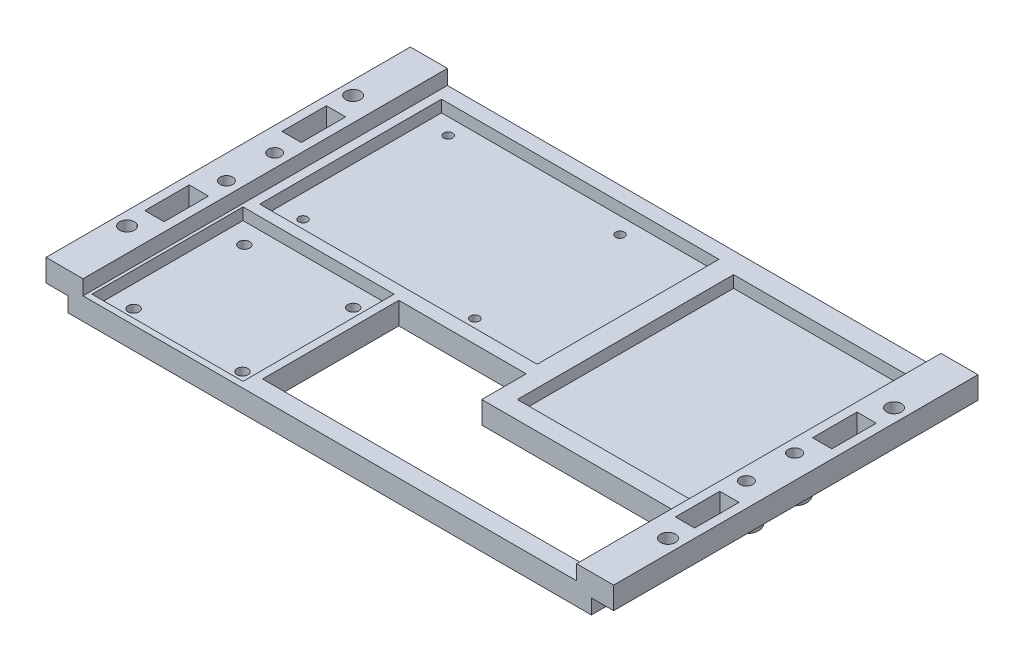
from build123d import *

# Parameters (mm, degrees)
PLATEFRAME_DEPTH          = 150
SKETCH3_R                 = 2.5
HOLESUPPORT_DEPTH         = 244.653052515
SKETCH4_R                 = 4.15
SKETCH4_R_2               = 2.15
CYLINDRICALSUPPORTS_DEPTH = 12.5
SKETCH5_W                 = 43
SKETCH5_H                 = 43
SKETCH5_W_2               = 89.65
SKETCH5_H_2               = 57.35
SKETCH5_W_3               = 58
SKETCH5_H_3               = 73
ITEMLAYOUT_DEPTH          = 4
HOLECUTOUT_DEPTH          = 7.5
SKETCH7_R                 = 1.5
HOLERASPBERRYPI_DEPTH     = 3.5
SKETCH8_R                 = 1.85
HOLEMOTORDRIVER_DEPTH     = 3.5
SKETCH10_W                = 45
SKETCH10_H                = 45
SKETCH10_W_2              = 43
SKETCH10_H_2              = 43
CUTMOTORDRIVER_DEPTH      = 4
SKETCH11_W                = 93.65
SKETCH11_H                = 61.35
SKETCH11_W_2              = 89.65
SKETCH11_H_2              = 57.35
CUTPASPBERRYPI_DEPTH      = 4
SKETCH12_W                = 191.6
SKETCH12_H                = 13
SKETCH12_H_2              = 14
CUTPLATEEDGES_DEPTH       = 12.5
SKETCH13_W                = 6.5
SKETCH13_H                = 15
CUTSHELLHOLES_DEPTH       = 12.5
SKETCH14_W                = 51
SKETCH14_H                = 51
CUTMOTORDRIVER2_DEPTH     = 4
SKETCH15_R                = 2.5
STANDOFFHOLES_DEPTH       = 236.293030071


with BuildPart() as part:
    # Sketch2 → PlateFrame (new body)
    with BuildSketch(Plane.XY):
        Polygon((179.1, 12.5), (191.6, 12.5), (191.6, 5), (184.1, 5), (184.1, 0), (7.5, 0), (7.5, 5), (0, 5), (0, 12.5), (12.5, 12.5), (12.5, 7.5), (179.1, 7.5), align=None)
    extrude(amount=PLATEFRAME_DEPTH)

    # Sketch3 → HoleSupport (cut, through all)
    with BuildSketch(Plane(origin=(0, 12.5, 0), x_dir=(1, 0, 0), z_dir=(0, 1, 0))):
        with Locations((8.05, -66.85)):
            Circle(SKETCH3_R)
        with Locations((8.05, -83.15)):
            Circle(SKETCH3_R)
        with Locations((183.55, -66.85)):
            Circle(SKETCH3_R)
        with Locations((183.55, -83.15)):
            Circle(SKETCH3_R)
    extrude(amount=-HOLESUPPORT_DEPTH, mode=Mode.SUBTRACT)

    # Sketch4 → CylindricalSupports (add)
    # profile 1 of 4: a face of its own
    with BuildSketch(Plane(origin=(0, 12.5, 0), x_dir=(1, 0, 0), z_dir=(0, 1, 0))):
        with Locations((183.55, -66.85)):
            Circle(SKETCH4_R)
        with Locations((183.55, -66.85)):
            Circle(SKETCH4_R_2, mode=Mode.SUBTRACT)
    # profile 2 of 4: a face of its own
    with BuildSketch(Plane(origin=(0, 12.5, 0), x_dir=(1, 0, 0), z_dir=(0, 1, 0))):
        with Locations((183.55, -83.15)):
            Circle(SKETCH4_R)
        with Locations((183.55, -83.15)):
            Circle(SKETCH4_R_2, mode=Mode.SUBTRACT)
    # profile 3 of 4: a face of its own
    with BuildSketch(Plane(origin=(0, 12.5, 0), x_dir=(1, 0, 0), z_dir=(0, 1, 0))):
        with Locations((8.05, -66.85)):
            Circle(SKETCH4_R)
        with Locations((8.05, -66.85)):
            Circle(SKETCH4_R_2, mode=Mode.SUBTRACT)
    # profile 4 of 4: a face of its own
    with BuildSketch(Plane(origin=(0, 12.5, 0), x_dir=(1, 0, 0), z_dir=(0, 1, 0))):
        with Locations((8.05, -83.15)):
            Circle(SKETCH4_R)
        with Locations((8.05, -83.15)):
            Circle(SKETCH4_R_2, mode=Mode.SUBTRACT)
    extrude(amount=-CYLINDRICALSUPPORTS_DEPTH)

    # Sketch5 → ItemLayout (cut)
    with BuildSketch(Plane(origin=(0, 7.5, 0), x_dir=(1, 0, 0), z_dir=(0, 1, 0))):
        with Locations((39, -108.5)):
            Rectangle(SKETCH5_W, SKETCH5_H)
        with Locations((62.325, -48.675)):
            Rectangle(SKETCH5_W_2, SKETCH5_H_2)
        with Locations((145.1, -56.5)):
            Rectangle(SKETCH5_W_3, SKETCH5_H_3)
    extrude(amount=-ITEMLAYOUT_DEPTH, mode=Mode.SUBTRACT)

    # Sketch6 → HoleCutout (cut)
    with BuildSketch(Plane(origin=(0, 7.5, 0), x_dir=(1, 0, 0), z_dir=(0, 1, 0))):
        Polygon((67.1, -84), (110.1, -84), (110.1, -99), (174.1, -99), (174.1, -130), (110.1, -130), (67.1, -130), align=None)
    extrude(amount=-HOLECUTOUT_DEPTH, mode=Mode.SUBTRACT)

    # Sketch7 → HoleRaspberryPi (cut)
    with BuildSketch(Plane(origin=(0, 3.5, 0), x_dir=(1, 0, 0), z_dir=(0, 1, 0))):
        with Locations((23.26, -23.5)):
            Circle(SKETCH7_R)
        with Locations((23.26, -72.5)):
            Circle(SKETCH7_R)
        with Locations((81.26, -72.5)):
            Circle(SKETCH7_R)
        with Locations((81.26, -23.5)):
            Circle(SKETCH7_R)
    extrude(amount=-HOLERASPBERRYPI_DEPTH, mode=Mode.SUBTRACT)

    # Sketch8 → HoleMotorDriver (cut)
    with BuildSketch(Plane(origin=(0, 3.5, 0), x_dir=(1, 0, 0), z_dir=(0, 1, 0))):
        with Locations((57.56, -127.24)):
            Circle(SKETCH8_R)
        with Locations((57.56, -89.86)):
            Circle(SKETCH8_R)
        with Locations((20.81, -89.86)):
            Circle(SKETCH8_R)
        with Locations((20.81, -127.24)):
            Circle(SKETCH8_R)
    extrude(amount=-HOLEMOTORDRIVER_DEPTH, mode=Mode.SUBTRACT)

    # Sketch10 → CutMotorDriver (cut)
    with BuildSketch(Plane(origin=(0, 7.5, 0), x_dir=(1, 0, 0), z_dir=(0, 1, 0))):
        with Locations((39, -108.5)):
            Rectangle(SKETCH10_W, SKETCH10_H)
        with Locations((39, -108.5)):
            Rectangle(SKETCH10_W_2, SKETCH10_H_2, mode=Mode.SUBTRACT)
    extrude(amount=-CUTMOTORDRIVER_DEPTH, mode=Mode.SUBTRACT)

    # Sketch11 → CutPaspberryPi (cut)
    with BuildSketch(Plane(origin=(0, 7.5, 0), x_dir=(1, 0, 0), z_dir=(0, 1, 0))):
        with Locations((62.325, -48.675)):
            Rectangle(SKETCH11_W, SKETCH11_H)
        with Locations((62.325, -48.675)):
            Rectangle(SKETCH11_W_2, SKETCH11_H_2, mode=Mode.SUBTRACT)
    extrude(amount=-CUTPASPBERRYPI_DEPTH, mode=Mode.SUBTRACT)

    # Sketch12 → CutPlateEdges (cut)
    with BuildSketch(Plane(origin=(0, 12.5, 0), x_dir=(1, 0, 0), z_dir=(0, 1, 0))):
        with Locations((95.8, -6.5)):
            Rectangle(SKETCH12_W, SKETCH12_H)
        with Locations((95.8, -143)):
            Rectangle(SKETCH12_W, SKETCH12_H_2)
    extrude(amount=-CUTPLATEEDGES_DEPTH, mode=Mode.SUBTRACT)

    # Sketch13 → CutShellHoles (cut)
    with BuildSketch(Plane(origin=(0, 12.5, 0), x_dir=(1, 0, 0), z_dir=(0, 1, 0))):
        with Locations((6.25, -51.85)):
            Rectangle(SKETCH13_W, SKETCH13_H)
        with Locations((6.25, -98.15)):
            Rectangle(SKETCH13_W, SKETCH13_H)
        with Locations((185.35, -51.85)):
            Rectangle(SKETCH13_W, SKETCH13_H)
        with Locations((185.35, -98.15)):
            Rectangle(SKETCH13_W, SKETCH13_H)
    extrude(amount=-CUTSHELLHOLES_DEPTH, mode=Mode.SUBTRACT)

    # Sketch14 → CutMotorDriver2 (cut)
    with BuildSketch(Plane(origin=(0, 7.5, 0), x_dir=(1, 0, 0), z_dir=(0, 1, 0))):
        with Locations((39, -108.5)):
            Rectangle(SKETCH14_W, SKETCH14_H)
    extrude(amount=-CUTMOTORDRIVER2_DEPTH, mode=Mode.SUBTRACT)

    # Sketch15 → StandoffHoles (cut, through all)
    with BuildSketch(Plane(origin=(0, 12.5, 0), x_dir=(1, 0, 0), z_dir=(0, 1, 0))):
        with Locations((4.5, -36.85)):
            Circle(SKETCH15_R)
        with Locations((4.5, -113.15)):
            Circle(SKETCH15_R)
        with Locations((187.1, -113.15)):
            Circle(SKETCH15_R)
        with Locations((187.1, -36.85)):
            Circle(SKETCH15_R)
    extrude(amount=-STANDOFFHOLES_DEPTH, mode=Mode.SUBTRACT)


solid = part.part
